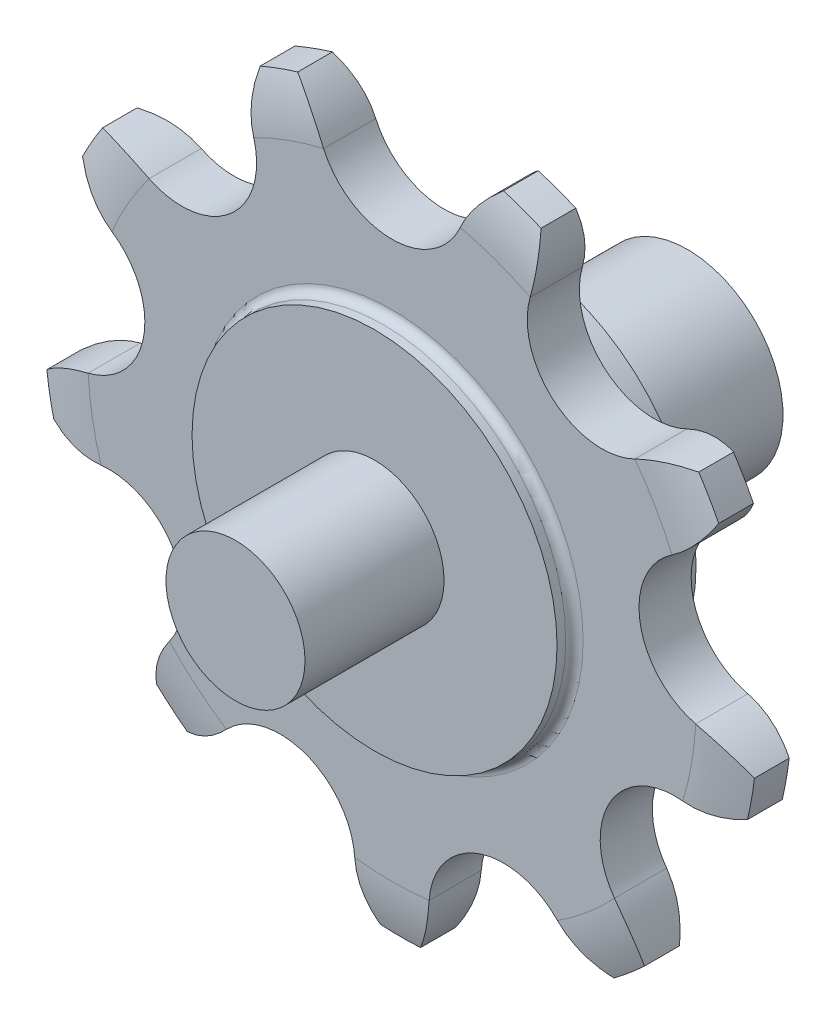
from build123d import *

# Parameters (mm, degrees)
BOSS_EXTRUDE1_DEPTH = 1.5
SKETCH3_R           = 10.5
BOSS_EXTRUDE2_DEPTH = 1
FILLET1_R           = 0.5
BOSS_EXTRUDE3_START = 4
SKETCH4_R           = 10.5
BOSS_EXTRUDE3_DEPTH = 4
FILLET2_R           = 0.5
SKETCH6_R           = 4
BOSS_EXTRUDE4_DEPTH = 8
SKETCH7_R           = 5.5
BOSS_EXTRUDE5_DEPTH = 10


with BuildPart() as part:
    # Sketch1 → Boss-Extrude1 (new, symmetric)
    with BuildSketch(Plane.XY):
        with BuildLine():
            ThreePointArc((8.079170849, 18.840833272), (7.548253676, 19.059744658), (7.011412938, 19.263698726))
            ThreePointArc((7.011412938, 19.263698726), (6.469069926, 19.452535421), (5.92165025, 19.62610655))
            ThreePointArc((5.92165025, 19.62610655), (4.769916061, 18.460076292), (3.92920603, 17.053191489))
            ThreePointArc((3.92920603, 17.053191489), (0, 14.5), (-3.92920603, 17.053191489))
            ThreePointArc((-3.92920603, 17.053191489), (-4.769916061, 18.460076292), (-5.92165025, 19.62610655))
            ThreePointArc((-5.92165025, 19.62610655), (-6.469069926, 19.452535421), (-7.011412938, 19.263698726))
            ThreePointArc((-7.011412938, 19.263698726), (-7.548253676, 19.059744658), (-8.079170849, 18.840833272))
            ThreePointArc((-8.079170849, 18.840833272), (-8.211940621, 17.207281806), (-7.95163375, 15.58914753))
            ThreePointArc((-7.95163375, 15.58914753), (-9.32042034, 11.107644425), (-13.97152664, 10.537857626))
            ThreePointArc((-13.97152664, 10.537857626), (-15.519876007, 11.07519592), (-17.151665385, 11.228106453))
            ThreePointArc((-17.151665385, 11.228106453), (-17.459443815, 10.743268669), (-17.753520778, 10.25))
            ThreePointArc((-17.753520778, 10.25), (-18.033665494, 9.748687545), (-18.299658117, 9.239724714))
            ThreePointArc((-18.299658117, 9.239724714), (-17.351339022, 7.903008926), (-16.111815726, 6.830768187))
            ThreePointArc((-16.111815726, 6.830768187), (-14.279712419, 2.517898576), (-17.476414659, -0.908256936))
            ThreePointArc((-17.476414659, -0.908256936), (-19.007913485, -1.491891711), (-20.356225667, -2.423649439))
            ThreePointArc((-20.356225667, -2.423649439), (-20.280349902, -2.992892892), (-20.188558937, -3.559787642))
            ThreePointArc((-20.188558937, -3.559787642), (-20.080924805, -4.123888815), (-19.957531975, -4.684753727))
            ThreePointArc((-19.957531975, -4.684753727), (-18.371853055, -5.099169663), (-16.73310006, -5.123803506))
            ThreePointArc((-16.73310006, -5.123803506), (-12.557368355, -7.25), (-12.80389403, -11.929387983))
            ThreePointArc((-12.80389403, -11.929387983), (-13.601936994, -13.360906629), (-14.035881725, -14.941352824))
            ThreePointArc((-14.035881725, -14.941352824), (-13.611854879, -15.328646605), (-13.177145999, -15.703911084))
            ThreePointArc((-13.177145999, -15.703911084), (-12.732096226, -16.066851767), (-12.277054818, -16.417183833))
            ThreePointArc((-12.277054818, -16.417183833), (-10.795972864, -15.715390096), (-9.524780909, -14.680890594))
            ThreePointArc((-9.524780909, -14.680890594), (-4.959292078, -13.625543001), (-2.140289085, -17.368625813))
            ThreePointArc((-2.140289085, -17.368625813), (-1.831463015, -18.978204846), (-1.147992733, -20.467831167))
            ThreePointArc((-1.147992733, -20.467831167), (-0.574221679, -20.491956214), (0, -20.5))
            ThreePointArc((0, -20.5), (0.574221679, -20.491956214), (1.147992733, -20.467831167))
            ThreePointArc((1.147992733, -20.467831167), (1.831463015, -18.978204846), (2.140289085, -17.368625813))
            ThreePointArc((2.140289085, -17.368625813), (4.959292078, -13.625543001), (9.524780909, -14.680890594))
            ThreePointArc((9.524780909, -14.680890594), (10.795972864, -15.715390096), (12.277054818, -16.417183833))
            ThreePointArc((12.277054818, -16.417183833), (12.732096226, -16.066851767), (13.177145999, -15.703911084))
            ThreePointArc((13.177145999, -15.703911084), (13.611854879, -15.328646605), (14.035881725, -14.941352824))
            ThreePointArc((14.035881725, -14.941352824), (13.601936994, -13.360906629), (12.80389403, -11.929387983))
            ThreePointArc((12.80389403, -11.929387983), (12.557368355, -7.25), (16.73310006, -5.123803506))
            ThreePointArc((16.73310006, -5.123803506), (18.371853055, -5.099169663), (19.957531975, -4.684753727))
            ThreePointArc((19.957531975, -4.684753727), (20.080924805, -4.123888815), (20.188558937, -3.559787642))
            ThreePointArc((20.188558937, -3.559787642), (20.280349902, -2.992892892), (20.356225667, -2.423649439))
            ThreePointArc((20.356225667, -2.423649439), (19.007913485, -1.491891711), (17.476414659, -0.908256936))
            ThreePointArc((17.476414659, -0.908256936), (14.279712419, 2.517898576), (16.111815726, 6.830768187))
            ThreePointArc((16.111815726, 6.830768187), (17.351339022, 7.903008926), (18.299658117, 9.239724714))
            ThreePointArc((18.299658117, 9.239724714), (18.033665494, 9.748687545), (17.753520778, 10.25))
            ThreePointArc((17.753520778, 10.25), (17.459443815, 10.743268669), (17.151665385, 11.228106453))
            ThreePointArc((17.151665385, 11.228106453), (15.519876007, 11.07519592), (13.97152664, 10.537857626))
            ThreePointArc((13.97152664, 10.537857626), (9.32042034, 11.107644425), (7.95163375, 15.58914753))
            ThreePointArc((7.95163375, 15.58914753), (8.211940621, 17.207281806), (8.079170849, 18.840833272))
        make_face()
    extrude(amount=BOSS_EXTRUDE1_DEPTH, both=True)

    # Sketch2 → Cut-Revolve2 (revolve, cut)
    with BuildSketch(Plane(origin=(0, 0, 0), x_dir=(0, 0, -1), z_dir=(1, 0, 0))):
        with BuildLine():
            Line((-1.5, -17.5), (-1.5, -20.5))
            Line((-1.5, -20.5), (-1, -20.5))
            ThreePointArc((-1, -20.5), (-1.374143795, -19.020690633), (-1.5, -17.5))
        make_face()
    cut_revolve2 = revolve(axis=Axis((0, 0, 0), (0, 0, 1)), mode=Mode.SUBTRACT)

    # Mirror1: Cut-Revolve2 across plane
    add(cut_revolve2.mirror(Plane.XY), mode=Mode.SUBTRACT)

    # Sketch3 → Boss-Extrude2 (add)
    with BuildSketch(Plane.XY.offset(1.5)):
        Circle(SKETCH3_R)
    extrude(amount=BOSS_EXTRUDE2_DEPTH)

    # Fillet1
    fillet1_edges = [part.edges().sort_by_distance(p)[0] for p in [
        (-10.5, 0, 1.5),
    ]]
    fillet(fillet1_edges, radius=FILLET1_R)

    # Sketch4 → Boss-Extrude3 (add)
    with BuildSketch(Plane(origin=(0, 0, -1.5), x_dir=(-1, 0, 0), z_dir=(0, 0, -1)).offset(BOSS_EXTRUDE3_START)):
        Circle(SKETCH4_R)
    extrude(amount=-BOSS_EXTRUDE3_DEPTH)

    # Fillet2
    fillet2_edges = [part.edges().sort_by_distance(p)[0] for p in [
        (10.5, 0, -1.5),
    ]]
    fillet(fillet2_edges, radius=FILLET2_R)

    # Sketch6 → Boss-Extrude4 (add)
    with BuildSketch(Plane.XY.offset(2.5)):
        Circle(SKETCH6_R)
    extrude(amount=BOSS_EXTRUDE4_DEPTH)

    # Sketch7 → Boss-Extrude5 (add)
    with BuildSketch(Plane(origin=(0, 0, -5.5), x_dir=(-1, 0, 0), z_dir=(0, 0, -1))):
        Circle(SKETCH7_R)
    extrude(amount=BOSS_EXTRUDE5_DEPTH)


solid = part.part
